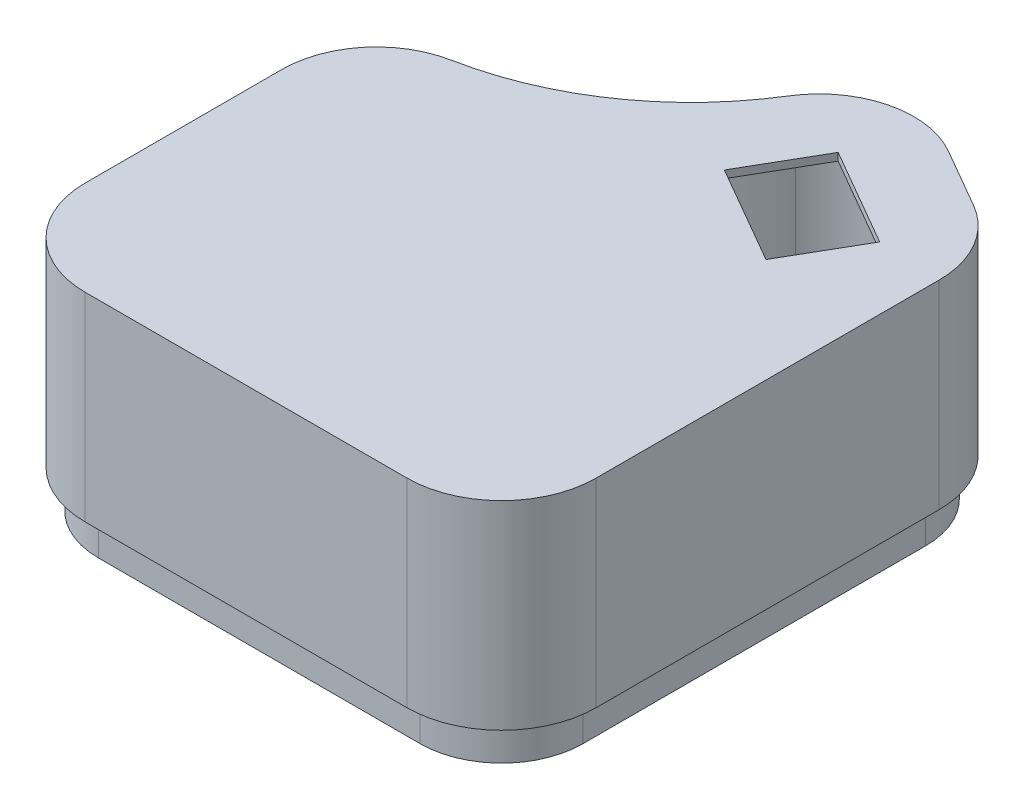
from build123d import *

# Parameters (mm, degrees)
SKETCH1_W               = 260
SKETCH1_H               = 100
BOSS_EXTRUDE1_DEPTH     = 3
CUT_EXTRUDE1_DEPTH      = 5
SKETCH5_W               = 260
SKETCH5_H               = 80
BOSS_EXTRUDE4_DEPTH     = 3
BOSS_EXTRUDE5_START     = 70
BOSS_EXTRUDE5_DEPTH     = 70
BOSS_EXTRUDE6_DEPTH     = 70
CUT_EXTRUDE3_DEPTH      = 198.810515393
SKETCH10_R              = 5
SKETCH10_R_2            = 1.75
BOSS_EXTRUDE7_DEPTH     = 50
CHAMFER1_SIZE           = 5
CHAMFER1_SIZE2          = 8.660254038
FILLET1_R               = 22
FILLET2_R               = 25
CUT_EXTRUDE4_START      = 20
CUT_EXTRUDE4_DEPTH      = 20
SKETCH12_R              = 1.75
CUT_EXTRUDE5_DEPTH      = 20
CUT_EXTRUDE6_DEPTH      = 40
FILLET3_R               = 5
BOSS_EXTRUDE8_DEPTH     = 10
CUT_EXTRUDE7_DEPTH      = 202.715145688
CUT_EXTRUDE7_DEPTH_BACK = 202.715145688
SKETCH16_W              = 135
SKETCH16_H              = 73
BOSS_EXTRUDE9_DEPTH     = 52.54
CUT_EXTRUDE8_DEPTH      = 5
CUT_EXTRUDE10_DEPTH     = 50.54


with BuildPart() as part:
    # Sketch1 → Boss-Extrude1 (new body)
    with BuildSketch(Plane(origin=(0, 0, 0), x_dir=(1, 0, 0), z_dir=(0, 1, 0))):
        Rectangle(SKETCH1_W, SKETCH1_H)
    extrude(amount=BOSS_EXTRUDE1_DEPTH)

    # Sketch4 → Cut-Extrude1 (cut)
    with BuildSketch(Plane(origin=(0, 3, 0), x_dir=(1, 0, 0), z_dir=(0, 1, 0))):
        with BuildLine():
            Line((-77.534249575, 30.291115131), (-130, 0))
            Line((-130, 0), (-130, 50))
            Line((-130, 50), (130, 50))
            Line((130, 50), (130, 0))
            Line((130, 0), (77.534249575, 30.291115131))
            ThreePointArc((77.534249575, 30.291115131), (0, -30), (-77.534249575, 30.291115131))
        make_face()
    extrude(amount=-CUT_EXTRUDE1_DEPTH, mode=Mode.SUBTRACT)

    # Sketch5 → Boss-Extrude4 (add)
    with BuildSketch(Plane(origin=(0, 3, 0), x_dir=(1, 0, 0), z_dir=(0, 1, 0))):
        with Locations((0, -90)):
            Rectangle(SKETCH5_W, SKETCH5_H)
    extrude(amount=-BOSS_EXTRUDE4_DEPTH)

    # Sketch6 → Boss-Extrude5 (add)
    with BuildSketch(Plane(origin=(0, 3, 0), x_dir=(1, 0, 0), z_dir=(0, 1, 0)).offset(BOSS_EXTRUDE5_START)):
        with BuildLine():
            Line((-77.534249575, 30.291115131), (-130, 0))
            Line((-130, 0), (-130, -130))
            Line((-130, -130), (130, -130))
            Line((130, -130), (130, 0))
            Line((130, 0), (77.534249575, 30.291115131))
            ThreePointArc((77.534249575, 30.291115131), (0, -30), (-77.534249575, 30.291115131))
        make_face()
        with BuildLine():
            Line((-79.381629809, 25.76042804), (-127, -1.732050808))
            Line((-127, -1.732050808), (-127, -127))
            Line((-127, -127), (127, -127))
            Line((127, -127), (127, -1.732050808))
            Line((127, -1.732050808), (79.381629809, 25.76042804))
            ThreePointArc((79.381629809, 25.76042804), (0, -33), (-79.381629809, 25.76042804))
        make_face(mode=Mode.SUBTRACT)
    extrude(amount=-BOSS_EXTRUDE5_DEPTH)

    # Sketch7 → Boss-Extrude6 (add)
    with BuildSketch(Plane(origin=(0, 73, 0), x_dir=(1, 0, 0), z_dir=(0, 1, 0))):
        with BuildLine():
            Line((-5, -32.849260709), (-5, -130))
            Line((-5, -130), (-2, -130))
            Line((-2, -130), (-2, -32.975900116))
            ThreePointArc((-2, -32.975900116), (-3.500572722, -32.92614781), (-5, -32.849260709))
        make_face()
    extrude(amount=-BOSS_EXTRUDE6_DEPTH)

    # Sketch9 → Cut-Extrude3 (cut, through all)
    with BuildSketch(Plane(origin=(0, 73, 0), x_dir=(1, 0, 0), z_dir=(0, 1, 0))):
        Polygon((-5, -32.849260709), (-5, -144.876678539), (-379.728059333, -144.876678539), (-379.728059333, 52.069032857), (-5, 52.069032857), align=None)
    extrude(amount=-CUT_EXTRUDE3_DEPTH, mode=Mode.SUBTRACT)

    # Sketch10 → Boss-Extrude7 (add)
    # profile 1 of 4: a face of its own
    with BuildSketch(Plane(origin=(0, 3, 0), x_dir=(1, 0, 0), z_dir=(0, 1, 0))):
        with Locations(Location((14, -46.75, 0), (0, 0, 90))):
            Circle(SKETCH10_R)
        with Locations(Location((14, -46.75, 0), (0, 0, 270))):
            Circle(SKETCH10_R_2, mode=Mode.SUBTRACT)
    # profile 2 of 4: a face of its own
    with BuildSketch(Plane(origin=(0, 3, 0), x_dir=(1, 0, 0), z_dir=(0, 1, 0))):
        with Locations(Location((86, -46.75, 0), (0, 0, 90))):
            Circle(SKETCH10_R)
        with Locations(Location((86, -46.75, 0), (0, 0, 270))):
            Circle(SKETCH10_R_2, mode=Mode.SUBTRACT)
    # profile 3 of 4: a face of its own
    with BuildSketch(Plane(origin=(0, 3, 0), x_dir=(1, 0, 0), z_dir=(0, 1, 0))):
        with Locations(Location((86, -113.25, 0), (0, 0, 90))):
            Circle(SKETCH10_R)
        with Locations(Location((86, -113.25, 0), (0, 0, 270))):
            Circle(SKETCH10_R_2, mode=Mode.SUBTRACT)
    # profile 4 of 4: a face of its own
    with BuildSketch(Plane(origin=(0, 3, 0), x_dir=(1, 0, 0), z_dir=(0, 1, 0))):
        with Locations(Location((14, -113.25, 0), (0, 0, 90))):
            Circle(SKETCH10_R)
        with Locations(Location((14, -113.25, 0), (0, 0, 270))):
            Circle(SKETCH10_R_2, mode=Mode.SUBTRACT)
    extrude(amount=BOSS_EXTRUDE7_DEPTH)

    # Chamfer1
    chamfer1_edges = [part.edges().sort_by_distance(p)[0] for p in [
        (86, 3, 51.75),
        (14, 3, 51.75),
        (86, 3, 118.25),
        (14, 3, 118.25),
    ]]
    chamfer1_side = [part.faces().sort_by_distance(p)[0] for p in [
        (68.049806081, 3, 64.998636776),
    ]]
    chamfer(chamfer1_edges, length=CHAMFER1_SIZE, length2=CHAMFER1_SIZE2, reference=chamfer1_side[0])

    # Fillet1
    fillet1_edges = [part.edges().sort_by_distance(p)[0] for p in [
        (-2, 38, 127),
        (-2, 38, 32.975900116),
        (127, 38, 127),
        (127, 38, 1.732050808),
        (79.381629809, 38, -25.76042804),
    ]]
    fillet(fillet1_edges, radius=FILLET1_R)

    # Fillet2
    fillet2_edges = [part.edges().sort_by_distance(p)[0] for p in [
        (-5, 36.5, 29.843597113),
        (-5, 36.5, 130),
        (77.534249575, 36.5, -30.291115131),
        (130, 36.5, 0),
        (130, 36.5, 130),
    ]]
    fillet(fillet2_edges, radius=FILLET2_R)

    # Sketch11 → Cut-Extrude4 (cut)
    with BuildSketch(Plane(origin=(0, 3, 0), x_dir=(1, 0, 0), z_dir=(0, 1, 0)).offset(CUT_EXTRUDE4_START)):
        with BuildLine():
            Line((52.464250206, -10.394556462), (54.431659589, -12.65935233))
            ThreePointArc((54.431659589, -12.65935233), (36.359512028, -24.612236832), (15.80952381, -31.480420697))
            Line((15.80952381, -31.480420697), (15.238095238, -28.53534525))
            ThreePointArc((15.238095238, -28.53534525), (35.045312798, -21.915408995), (52.464250206, -10.394556462))
        make_face()
        Polygon((101.737077009, 16.317606197), (100.237077009, 13.719529986), (116, 4.618802154), (117.5, 7.216878365), align=None)
    extrude(amount=-CUT_EXTRUDE4_DEPTH, mode=Mode.SUBTRACT)

    # Sketch12 → Cut-Extrude5 (cut)
    with BuildSketch(Plane(origin=(0, 3, 0), x_dir=(1, 0, 0), z_dir=(0, 1, 0))):
        with Locations(Location((89.237077009, -5.333028897, 0), (0, 0, 270))):
            Circle(SKETCH12_R)
        with Locations(Location((105, -105, 0), (0, 0, 270))):
            Circle(SKETCH12_R)
        with Locations(Location((15, -105, 0), (0, 0, 66.494954424))):
            Circle(SKETCH12_R)
        with Locations(Location((15, -55, 0), (0, 0, 260.317408662))):
            Circle(SKETCH12_R)
    extrude(amount=-CUT_EXTRUDE5_DEPTH, mode=Mode.SUBTRACT)

    # Sketch14 → Cut-Extrude6 (cut)
    with BuildSketch(Plane.XZ.offset(-23)):
        Polygon((101.737077009, -16.317606197), (117.5, -7.216878365), (116, -4.618802154), (100.237077009, -13.719529986), align=None)
    extrude(amount=-CUT_EXTRUDE6_DEPTH, mode=Mode.SUBTRACT)

    # Fillet3
    # the kernel refuses this fillet: 5 mm, written as the material it adds along each edge
    with BuildSketch(Plane(origin=(101.737077009, 3, -16.317606197), x_dir=(0.8660254037844373, 0, 0.5000000000000024), z_dir=(-0.5000000000000026, 0, 0.8660254037844373))) as fillet3_piece_1_section:
        with BuildLine():
            CenterArc((FILLET3_R, FILLET3_R), FILLET3_R, 180, 90)
            Line((0, FILLET3_R), (0, 0))
            Line((0, 0), (FILLET3_R, 0))
        make_face()
    fillet3_piece_1 = extrude(amount=15.5, mode=Mode.PRIVATE)
    fillet3_piece_1 = fillet3_piece_1 - Plane(origin=(89.237077009, 3.433810283, 5.333028897), x_dir=(-0.8498769238912803, 0, -0.5269812275945843), z_dir=(0, -1, 0)) * Cylinder(22, 52, mode=Mode.PRIVATE)
    add(fillet3_piece_1)
    with BuildSketch(Plane(origin=(109.75, 3, 6.206515394), x_dir=(-0.8660254037844346, 0, -0.500000000000007), z_dir=(0.500000000000007, 0, -0.8660254037844346))) as fillet3_piece_2_section:
        with BuildLine():
            CenterArc((FILLET3_R, FILLET3_R), FILLET3_R, 180, 90)
            Line((0, FILLET3_R), (0, 0))
            Line((0, 0), (FILLET3_R, 0))
        make_face()
    fillet3_piece_2 = extrude(amount=15.5, mode=Mode.PRIVATE)
    fillet3_piece_2 = fillet3_piece_2 - Plane(origin=(105, 4.115508028, 14.43375673), x_dir=(0.5000000000000037, 0, -0.8660254037844366), z_dir=(0, -1, 0)) * Cylinder(22, 51, mode=Mode.PRIVATE)
    add(fillet3_piece_2)
    with BuildSketch(Plane(origin=(44.266711112, 3, 0.957907015), x_dir=(-0.754931955778907, 0, 0.6558031275800951), z_dir=(0.6558031275800951, 0, 0.754931955778907))) as fillet3_piece_3_section:
        with BuildLine():
            CenterArc((FILLET3_R, -FILLET3_R), FILLET3_R, 90, 90)
            Line((0, -FILLET3_R), (0, 0))
            Line((0, 0), (FILLET3_R, 0))
        make_face()
    fillet3_piece_3 = extrude(amount=28, mode=Mode.PRIVATE)
    fillet3_piece_3 = fillet3_piece_3 & Plane(origin=(0, 4.116736713, -50), x_dir=(0.9564051784275456, 0, 0.2920430356590872), z_dir=(0, 1, 0)) * Cylinder(83, 77, mode=Mode.PRIVATE)
    fillet3_piece_3 = fillet3_piece_3 - Plane(origin=(0, 4.116736713, -50), x_dir=(0.9691781196921706, 0, 0.2463610608638238), z_dir=(0, 1, 0)) * Cylinder(80, 77, mode=Mode.PRIVATE)
    add(fillet3_piece_3)
    with BuildSketch(Plane(origin=(18.19047619, 3, 43.751568392), x_dir=(0.9816918156232519, 0, -0.19047619047619338), z_dir=(-0.19047619047619338, 0, -0.981691815623252))) as fillet3_piece_4_section:
        with BuildLine():
            CenterArc((FILLET3_R, -FILLET3_R), FILLET3_R, 90, 90)
            Line((0, -FILLET3_R), (0, 0))
            Line((0, 0), (FILLET3_R, 0))
        make_face()
    fillet3_piece_4 = extrude(amount=28, mode=Mode.PRIVATE)
    fillet3_piece_4 = fillet3_piece_4 - Plane(origin=(20, 4.115502573, 53.07764064), x_dir=(-0.19047619047619013, 0, -0.9816918156232526), z_dir=(0, -1, 0)) * Cylinder(22, 77, mode=Mode.PRIVATE)
    fillet3_piece_4 = fillet3_piece_4 - Plane(origin=(0, 4.115502573, -50), x_dir=(0.9691781196921706, 0, 0.2463610608638238), z_dir=(0, 1, 0)) * Cylinder(80, 77, mode=Mode.PRIVATE)
    add(fillet3_piece_4)
    with BuildSketch(Plane(origin=(44.266711112, 23, 0.957907015), x_dir=(-0.754931955778907, 0, 0.6558031275800951), z_dir=(0.6558031275800951, 0, 0.754931955778907))) as fillet3_piece_5_section:
        with BuildLine():
            CenterArc((FILLET3_R, FILLET3_R), FILLET3_R, 180, 90)
            Line((0, FILLET3_R), (0, 0))
            Line((0, 0), (FILLET3_R, 0))
        make_face()
    fillet3_piece_5 = extrude(amount=28, mode=Mode.PRIVATE)
    fillet3_piece_5 = fillet3_piece_5 & Plane(origin=(0, 21.883263287, -50), x_dir=(0.9564051784275456, 0, 0.2920430356590872), z_dir=(0, 1, 0)) * Cylinder(83, 77, mode=Mode.PRIVATE)
    fillet3_piece_5 = fillet3_piece_5 - Plane(origin=(0, 21.883263287, -50), x_dir=(0.9691781196921706, 0, 0.2463610608638238), z_dir=(0, 1, 0)) * Cylinder(80, 77, mode=Mode.PRIVATE)
    add(fillet3_piece_5)
    with BuildSketch(Plane(origin=(18.19047619, 23, 43.751568392), x_dir=(0, -1, 0), z_dir=(-0.19047619047619338, 0, -0.981691815623252))) as fillet3_piece_6_section:
        with BuildLine():
            CenterArc((FILLET3_R, -FILLET3_R), FILLET3_R, 90, 90)
            Line((0, -FILLET3_R), (0, 0))
            Line((0, 0), (FILLET3_R, 0))
        make_face()
    fillet3_piece_6 = extrude(amount=28, mode=Mode.PRIVATE)
    fillet3_piece_6 = fillet3_piece_6 & Plane(origin=(0, 21.870297326, -50), x_dir=(0.9564051784275456, 0, 0.2920430356590872), z_dir=(0, 1, 0)) * Cylinder(83, 77, mode=Mode.PRIVATE)
    fillet3_piece_6 = fillet3_piece_6 - Plane(origin=(0, 21.870297326, -50), x_dir=(0.9691781196921706, 0, 0.2463610608638238), z_dir=(0, 1, 0)) * Cylinder(80, 77, mode=Mode.PRIVATE)
    add(fillet3_piece_6)
    with BuildSketch(Plane(origin=(100.237077009, 63, -13.719529986), x_dir=(0.866025403784437, 0, 0.5000000000000028), z_dir=(0.5000000000000028, 0, -0.866025403784437))) as fillet3_piece_7:
        with BuildLine():
            CenterArc((FILLET3_R, FILLET3_R), FILLET3_R, 180, 90)
            Line((0, FILLET3_R), (0, 0))
            Line((0, 0), (FILLET3_R, 0))
        make_face()
    extrude(amount=3)
    with BuildSketch(Plane(origin=(117.5, 63, -7.216878365), x_dir=(0, -1, 0), z_dir=(-0.500000000000007, 0, 0.8660254037844346))) as fillet3_piece_8:
        with BuildLine():
            CenterArc((FILLET3_R, -FILLET3_R), FILLET3_R, 90, 90)
            Line((0, -FILLET3_R), (0, 0))
            Line((0, 0), (FILLET3_R, 0))
        make_face()
    extrude(amount=3)

    # Sketch16 → Cut-Extrude7 (cut, two sides: drawn at the far end of the back side and taken through both)
    with BuildSketch(Plane.XY.offset(-CUT_EXTRUDE7_DEPTH_BACK)):
        with Locations((62.5, 36.5)):
            Rectangle(SKETCH16_W, SKETCH16_H)
    extrude(amount=CUT_EXTRUDE7_DEPTH + CUT_EXTRUDE7_DEPTH_BACK, mode=Mode.SUBTRACT)


with BuildPart() as body_2:
    # Sketch15 → Boss-Extrude8 (new body)
    with BuildSketch(Plane(origin=(0, 73, 0), x_dir=(1, 0, 0), z_dir=(0, 1, 0))):
        with BuildLine():
            Line((126.5, -105), (126.5, -14.43375673))
            ThreePointArc((126.5, -14.43375673), (123.619546181, -3.68375673), (115.75, 4.185789452))
            Line((115.75, 4.185789452), (99.987077009, 13.286517284))
            ThreePointArc((99.987077009, 13.286517284), (83.999666249, 15.519297796), (70.964723145, 5.997067496))
            ThreePointArc((70.964723145, 5.997067496), (47.402272696, -18.740632403), (15.904761905, -31.971266605))
            ThreePointArc((15.904761905, -31.971266605), (3.412389879, -39.399146919), (-1.5, -53.07764064))
            Line((-1.5, -53.07764064), (-1.5, -105))
            ThreePointArc((-1.5, -105), (4.797204204, -120.202795796), (20, -126.5))
            Line((20, -126.5), (105, -126.5))
            ThreePointArc((105, -126.5), (120.202795796, -120.202795796), (126.5, -105))
        make_face()
        with BuildLine():
            Line((124.5, -105), (124.5, -14.43375673))
            ThreePointArc((124.5, -14.43375673), (121.887495374, -4.68375673), (114.75, 2.453738644))
            Line((114.75, 2.453738644), (98.987077009, 11.554466476))
            ThreePointArc((98.987077009, 11.554466476), (84.48686725, 13.579546476), (72.664476993, 4.943105041))
            ThreePointArc((72.664476993, 4.943105041), (48.537656474, -20.387114617), (16.285714286, -33.934650236))
            ThreePointArc((16.285714286, -33.934650236), (4.955423379, -40.67156494), (0.5, -53.07764064))
            Line((0.5, -53.07764064), (0.5, -105))
            ThreePointArc((0.5, -105), (6.211417767, -118.788582233), (20, -124.5))
            Line((20, -124.5), (105, -124.5))
            ThreePointArc((105, -124.5), (118.788582233, -118.788582233), (124.5, -105))
        make_face(mode=Mode.SUBTRACT)
    extrude(amount=BOSS_EXTRUDE8_DEPTH)

    # Sketch17 → Boss-Extrude9 (add)
    with BuildSketch(Plane(origin=(0, 83, 0), x_dir=(1, 0, 0), z_dir=(0, 1, 0))):
        with BuildLine():
            Line((130, -105), (130, -14.43375673))
            ThreePointArc((130, -14.43375673), (126.650635095, -1.93375673), (117.5, 7.216878365))
            Line((117.5, 7.216878365), (101.737077009, 16.317606197))
            ThreePointArc((101.737077009, 16.317606197), (83.147064497, 18.913862607), (67.990153911, 7.841501792))
            ThreePointArc((67.990153911, 7.841501792), (45.415351086, -15.85928853), (15.238095238, -28.53534525))
            ThreePointArc((15.238095238, -28.53534525), (0.712081255, -37.172415383), (-5, -53.07764064))
            Line((-5, -53.07764064), (-5, -105))
            ThreePointArc((-5, -105), (2.32233047, -122.67766953), (20, -130))
            Line((20, -130), (105, -130))
            ThreePointArc((105, -130), (122.67766953, -122.67766953), (130, -105))
        make_face()
    extrude(amount=BOSS_EXTRUDE9_DEPTH)

    # Sketch18 → Cut-Extrude8 (cut)
    with BuildSketch(Plane(origin=(0, 135.54, 0), x_dir=(1, 0, 0), z_dir=(0, 1, 0))):
        Polygon((87.451905284, 1.47114317), (113.432667397, -13.52885683), (102.432667397, -32.581415713), (76.451905284, -17.581415713), align=None)
    extrude(amount=-CUT_EXTRUDE8_DEPTH, mode=Mode.SUBTRACT)

    # Sketch20 → Cut-Extrude10 (cut)
    with BuildSketch(Plane.XZ.offset(-83)):
        with BuildLine():
            Line((124.5, 14.43375673), (124.5, 105))
            ThreePointArc((124.5, 105), (118.788582233, 118.788582233), (105, 124.5))
            Line((105, 124.5), (20, 124.5))
            ThreePointArc((20, 124.5), (6.211417767, 118.788582233), (0.5, 105))
            Line((0.5, 105), (0.5, 53.07764064))
            ThreePointArc((0.5, 53.07764064), (4.955423379, 40.67156494), (16.285714286, 33.934650236))
            ThreePointArc((16.285714286, 33.934650236), (48.537656474, 20.387114617), (72.664476993, -4.943105041))
            ThreePointArc((72.664476993, -4.943105041), (84.48686725, -13.579546476), (98.987077009, -11.554466476))
            Line((98.987077009, -11.554466476), (114.75, -2.453738644))
            ThreePointArc((114.75, -2.453738644), (121.887495374, 4.68375673), (124.5, 14.43375673))
        make_face()
    extrude(amount=-CUT_EXTRUDE10_DEPTH, mode=Mode.SUBTRACT)


solid = body_2.part
